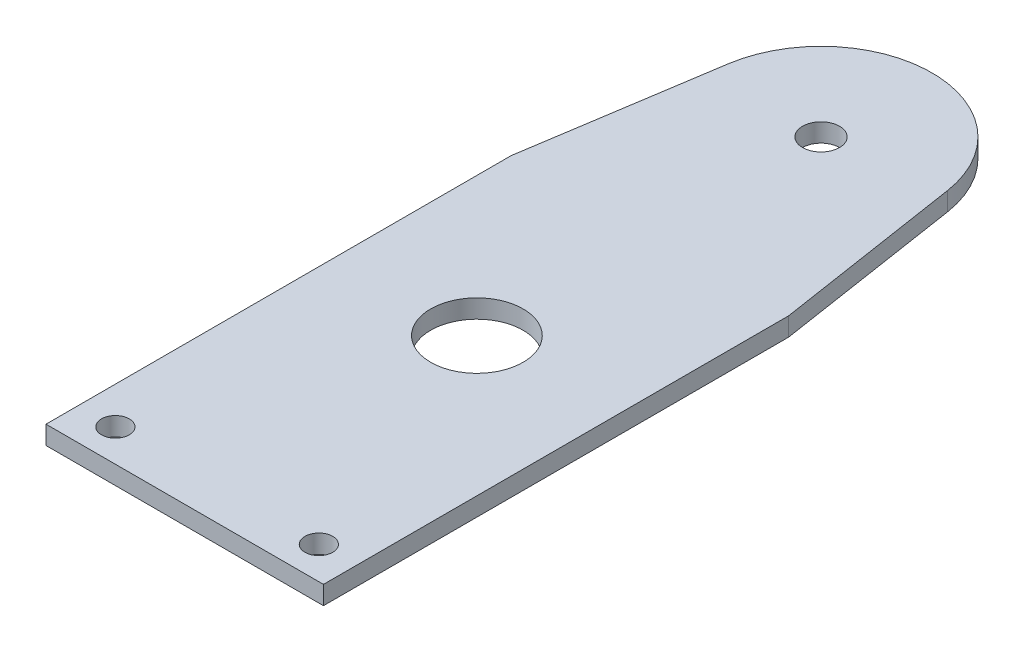
from build123d import *

# Parameters (mm, degrees)
SKETCH_1_R      = 1.5
SKETCH_1_R_2    = 2
SKETCH_1_R_3    = 5
EXTRUDE_1_DEPTH = 2


with BuildPart() as part:
    # Эскиз1 → Бобышка-Вытянуть1 (new body)
    with BuildSketch(Plane(origin=(0, 0, 0), x_dir=(1, 0, 0), z_dir=(0, 1, 0))):
        with BuildLine():
            Line((12.374772085, -29.617278809), (12.374772085, 20.682721191))
            Line((12.374772085, 20.682721191), (9.234119843, 41.014624779))
            ThreePointArc((9.234119843, 41.014624779), (-2.625227915, 51.182721191), (-14.484575673, 41.014624779))
            Line((-14.484575673, 41.014624779), (-17.625227915, 20.682721191))
            Line((-17.625227915, 20.682721191), (-17.625227915, -29.617278809))
            Line((-17.625227915, -29.617278809), (-10.625227915, -29.617278809))
            Line((-10.625227915, -29.617278809), (5.374772085, -29.617278809))
            Line((5.374772085, -29.617278809), (12.374772085, -29.617278809))
        make_face()
        with Locations((-13.625227915, -26.117278809)):
            Circle(SKETCH_1_R, mode=Mode.SUBTRACT)
        with Locations((8.374772085, -26.117278809)):
            Circle(SKETCH_1_R, mode=Mode.SUBTRACT)
        with Locations((-2.625227915, 39.182721191)):
            Circle(SKETCH_1_R_2, mode=Mode.SUBTRACT)
        with Locations((-2.625227915, 1.972721191)):
            Circle(SKETCH_1_R_3, mode=Mode.SUBTRACT)
    extrude(amount=EXTRUDE_1_DEPTH)


solid = part.part
